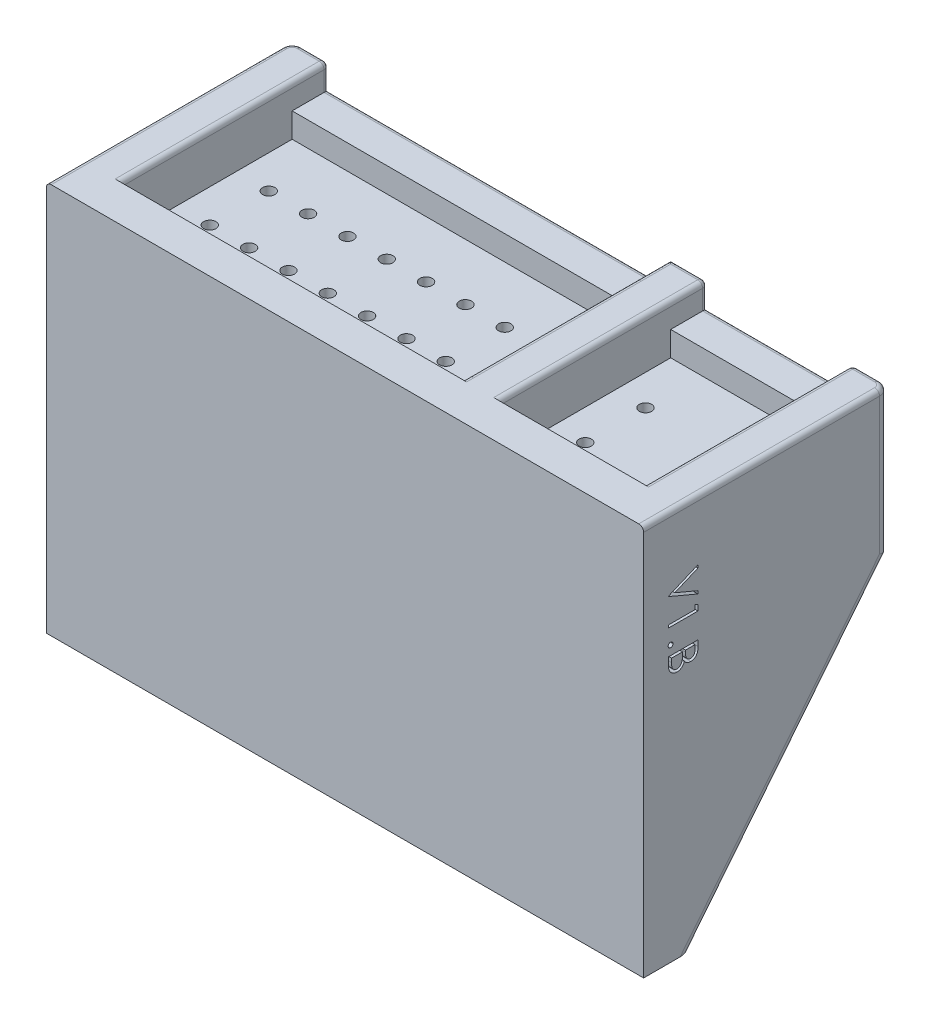
from build123d import *

# Parameters (mm, degrees)
SKETCH1_W           = 121.5
SKETCH1_H           = 50
BOSS_EXTRUDE1_DEPTH = 29.5
SKETCH2_W           = 29.5
SKETCH2_H           = 35
CUT_EXTRUDE1_DEPTH  = 10
SKETCH3_W           = 69.5
SKETCH3_H           = 35
CUT_EXTRUDE2_DEPTH  = 10
SKETCH5_R           = 1.25
CUT_EXTRUDE4_DEPTH  = 69.525998716
SKETCH6_R           = 1.25
CUT_EXTRUDE5_DEPTH  = 69.525998716
SKETCH8_W           = 69.5
SKETCH8_H           = 7.5
SKETCH8_W_2         = 29.5
CUT_EXTRUDE7_DEPTH  = 5
FILLET1_R           = 1
SKETCH9_W           = 121.5
SKETCH9_H           = 10
BOSS_EXTRUDE2_DEPTH = 50
BOSS_EXTRUDE3_DEPTH = 10
FILLET3_R           = 2
SKETCH11_W          = 101.5
SKETCH11_H          = 24.25
RECESS_DEPTH        = 2
CUT_EXTRUDE9_DEPTH  = 2


with BuildPart() as part:
    # Sketch1 → Boss-Extrude1 (new body)
    with BuildSketch(Plane(origin=(0, 0, 0), x_dir=(1, 0, 0), z_dir=(0, 1, 0))):
        Rectangle(SKETCH1_W, SKETCH1_H)
    extrude(amount=BOSS_EXTRUDE1_DEPTH)

    # Sketch2 → Cut-Extrude1 (cut)
    with BuildSketch(Plane(origin=(0, 29.5, 0), x_dir=(1, 0, 0), z_dir=(0, 1, 0))):
        with Locations((38.5, 0)):
            Rectangle(SKETCH2_W, SKETCH2_H)
    extrude(amount=-CUT_EXTRUDE1_DEPTH, mode=Mode.SUBTRACT)

    # Sketch3 → Cut-Extrude2 (cut)
    with BuildSketch(Plane(origin=(0, 29.5, 0), x_dir=(1, 0, 0), z_dir=(0, 1, 0))):
        with Locations((-18.5, 0)):
            Rectangle(SKETCH3_W, SKETCH3_H)
    extrude(amount=-CUT_EXTRUDE2_DEPTH, mode=Mode.SUBTRACT)

    # Sketch5 → Cut-Extrude4 (cut, through all)
    with BuildSketch(Plane(origin=(0, 19.5, 0), x_dir=(1, 0, 0), z_dir=(0, 1, 0))):
        with Locations(Location((-46.5, 6, 0), (0, 0, 270))):
            Circle(SKETCH5_R)
        with Locations(Location((-38.5, 6, 0), (0, 0, 270))):
            Circle(SKETCH5_R)
        with Locations(Location((-30.5, 6, 0), (0, 0, 270))):
            Circle(SKETCH5_R)
        with Locations(Location((-22.5, 6, 0), (0, 0, 270))):
            Circle(SKETCH5_R)
        with Locations(Location((-14.5, 6, 0), (0, 0, 270))):
            Circle(SKETCH5_R)
        with Locations(Location((-6.5, 6, 0), (0, 0, 270))):
            Circle(SKETCH5_R)
        with Locations(Location((1.5, 6, 0), (0, 0, 270))):
            Circle(SKETCH5_R)
        with Locations(Location((9.5, 6, 0), (0, 0, 270))):
            Circle(SKETCH5_R)
        with Locations(Location((-38.5, -6, 0), (0, 0, 270))):
            Circle(SKETCH5_R)
        with Locations(Location((-30.5, -6, 0), (0, 0, 270))):
            Circle(SKETCH5_R)
        with Locations(Location((-22.5, -6, 0), (0, 0, 270))):
            Circle(SKETCH5_R)
        with Locations(Location((-14.5, -6, 0), (0, 0, 270))):
            Circle(SKETCH5_R)
        with Locations(Location((-6.5, -6, 0), (0, 0, 270))):
            Circle(SKETCH5_R)
        with Locations(Location((1.5, -6, 0), (0, 0, 270))):
            Circle(SKETCH5_R)
        with Locations(Location((9.5, -6, 0), (0, 0, 270))):
            Circle(SKETCH5_R)
        with Locations(Location((-46.5, -6, 0), (0, 0, 270))):
            Circle(SKETCH5_R)
    extrude(amount=-CUT_EXTRUDE4_DEPTH, mode=Mode.SUBTRACT)

    # Sketch6 → Cut-Extrude5 (cut, through all)
    with BuildSketch(Plane(origin=(0, 19.5, 0), x_dir=(1, 0, 0), z_dir=(0, 1, 0))):
        with Locations(Location((30, 6.125, 0), (0, 0, 270))):
            Circle(SKETCH6_R)
        with Locations(Location((46, 6.125, 0), (0, 0, 270))):
            Circle(SKETCH6_R)
    cut_extrude5 = extrude(amount=-CUT_EXTRUDE5_DEPTH, mode=Mode.SUBTRACT)

    # Mirror3: Cut-Extrude5 across plane
    add(cut_extrude5.mirror(Plane.XY), mode=Mode.SUBTRACT)

    # Sketch8 → Cut-Extrude7 (cut)
    with BuildSketch(Plane(origin=(0, 29.5, 0), x_dir=(1, 0, 0), z_dir=(0, 1, 0))):
        with Locations((-18.5, 21.25)):
            Rectangle(SKETCH8_W, SKETCH8_H)
        with Locations((38.5, 21.25)):
            Rectangle(SKETCH8_W_2, SKETCH8_H)
    extrude(amount=-CUT_EXTRUDE7_DEPTH, mode=Mode.SUBTRACT)

    # Fillet1
    fillet1_edges = [part.edges().sort_by_distance(p)[0] for p in [
        (20, 29.5, -25),
        (-60.75, 29.5, 0),
        (-57, 29.5, -25),
        (-18.5, 24.5, -25),
        (-53.25, 27, -25),
        (38.5, 24.5, -25),
        (23.75, 27, -25),
        (53.25, 27, -25),
        (53.25, 29.5, -3.75),
        (23.75, 29.5, -3.75),
        (16.25, 29.5, -3.75),
        (-53.25, 29.5, -3.75),
        (60.75, 29.5, 0),
        (57, 29.5, -25),
    ]]
    fillet(fillet1_edges, radius=FILLET1_R)

    # Sketch9 → Boss-Extrude2 (add)
    with BuildSketch(Plane.XZ):
        with Locations((0, 20)):
            Rectangle(SKETCH9_W, SKETCH9_H)
    extrude(amount=BOSS_EXTRUDE2_DEPTH)

    # Sketch10 → Boss-Extrude3 (add)
    with BuildSketch(Plane.ZY.offset(60.75)):
        Polygon((-25, 0), (15, -50), (15, 0), align=None)
    boss_extrude3 = extrude(amount=-BOSS_EXTRUDE3_DEPTH)

    # Mirror4: Boss-Extrude3 across plane
    add(boss_extrude3.mirror(Plane(origin=(0, 0, 0), x_dir=(0, 0, 1), z_dir=(1, 0, 0))))

    # Fillet3
    # the kernel refuses this fillet: 2 mm, written as the material it takes off along each edge
    with BuildSketch(Plane(origin=(58.75, 29.5, -23), x_dir=(1, 0, 0), z_dir=(0, 0, 1))) as fillet3_piece_1:
        with BuildLine():
            CenterArc((1, -1), 1, 0, 90)
            Line((2, -1), (2, 0))
            Line((2, 0), (1, 0))
        make_face()
    revolve(axis=Axis((58.75, 29.5, -23), (0, 1, 0)), revolution_arc=90, mode=Mode.SUBTRACT)
    with BuildSketch(Plane(origin=(-58.75, 29.5, -23), x_dir=(0, 0, -1), z_dir=(1, 0, 0))) as fillet3_piece_2:
        with BuildLine():
            CenterArc((1, -1), 1, 0, 90)
            Line((2, -1), (2, 0))
            Line((2, 0), (1, 0))
        make_face()
    revolve(axis=Axis((-58.75, 29.5, -23), (0, 1, 0)), revolution_arc=90, mode=Mode.SUBTRACT)
    with BuildSketch(Plane(origin=(60.75, -5, -25), x_dir=(0, 0, 1), z_dir=(0, 1, 0))) as fillet3_piece_3:
        with BuildLine():
            CenterArc((FILLET3_R, -FILLET3_R), FILLET3_R, 90, 90)
            Line((0, -FILLET3_R), (0, 0))
            Line((0, 0), (FILLET3_R, 0))
        make_face()
    extrude(amount=34.5, mode=Mode.SUBTRACT)
    with BuildSketch(Plane(origin=(-60.75, -5, -25), x_dir=(0, 0, 1), z_dir=(0, 1, 0))) as fillet3_piece_4:
        with BuildLine():
            CenterArc((FILLET3_R, FILLET3_R), FILLET3_R, 180, 90)
            Line((0, FILLET3_R), (0, 0))
            Line((0, 0), (FILLET3_R, 0))
        make_face()
    extrude(amount=34.5, mode=Mode.SUBTRACT)
    with BuildSketch(Plane(origin=(-50.75, 3.904344047, -28.123475238), x_dir=(-1, 0, 0), z_dir=(0, -0.7808688094430305, 0.6246950475544242))) as fillet3_piece_5_section:
        with BuildLine():
            CenterArc((FILLET3_R, -FILLET3_R), FILLET3_R, 90, 90)
            Line((0, -FILLET3_R), (0, 0))
            Line((0, 0), (FILLET3_R, 0))
        make_face()
    fillet3_piece_5 = extrude(amount=74.031242374, mode=Mode.PRIVATE)
    fillet3_piece_5 = split(fillet3_piece_5, bisect_by=Plane(origin=(-51.199423068, -24.646092888, 15), z_dir=(0, 0, -1)), keep=Keep.TOP, mode=Mode.PRIVATE)
    fillet3_piece_5 = split(fillet3_piece_5, bisect_by=Plane(origin=(-51.199423068, 0, -4.716874311), z_dir=(0, -1, 0)), keep=Keep.TOP, mode=Mode.PRIVATE)
    add(fillet3_piece_5, mode=Mode.SUBTRACT)
    with BuildSketch(Plane(origin=(-60.75, 3.904344047, -28.123475238), x_dir=(0, 0.6246950475544242, 0.7808688094430305), z_dir=(0, -0.7808688094430305, 0.6246950475544242))) as fillet3_piece_6:
        with BuildLine():
            CenterArc((FILLET3_R, -FILLET3_R), FILLET3_R, 90, 90)
            Line((0, -FILLET3_R), (0, 0))
            Line((0, 0), (FILLET3_R, 0))
        make_face()
    extrude(amount=74.031242374, mode=Mode.SUBTRACT)
    with BuildSketch(Plane(origin=(60.75, 3.904344047, -28.123475238), x_dir=(0, 0.6246950475544242, 0.7808688094430305), z_dir=(0, -0.7808688094430305, 0.6246950475544242))) as fillet3_piece_7:
        with BuildLine():
            CenterArc((FILLET3_R, FILLET3_R), FILLET3_R, 180, 90)
            Line((0, FILLET3_R), (0, 0))
            Line((0, 0), (FILLET3_R, 0))
        make_face()
    extrude(amount=74.031242374, mode=Mode.SUBTRACT)
    with BuildSketch(Plane(origin=(50.75, 3.904344047, -28.123475238), x_dir=(1, 0, 0), z_dir=(0, -0.7808688094430305, 0.6246950475544242))) as fillet3_piece_8_section:
        with BuildLine():
            CenterArc((FILLET3_R, FILLET3_R), FILLET3_R, 180, 90)
            Line((0, FILLET3_R), (0, 0))
            Line((0, 0), (FILLET3_R, 0))
        make_face()
    fillet3_piece_8 = extrude(amount=74.031242374, mode=Mode.PRIVATE)
    fillet3_piece_8 = split(fillet3_piece_8, bisect_by=Plane(origin=(51.199423068, -24.646092888, 15), z_dir=(0, 0, -1)), keep=Keep.TOP, mode=Mode.PRIVATE)
    fillet3_piece_8 = split(fillet3_piece_8, bisect_by=Plane(origin=(51.199423068, 0, -4.716874311), z_dir=(0, -1, 0)), keep=Keep.TOP, mode=Mode.PRIVATE)
    add(fillet3_piece_8, mode=Mode.SUBTRACT)

    # Sketch11 → Recess (cut)
    with BuildSketch(Plane.XZ):
        Rectangle(SKETCH11_W, SKETCH11_H)
    extrude(amount=-RECESS_DEPTH, mode=Mode.SUBTRACT)

    # Sketch12 → Cut-Extrude9 (cut)
    # profile 1 of 4: a face of its own
    with BuildSketch(Plane(origin=(60.75, 0, 0), x_dir=(0, 0, -1), z_dir=(1, 0, 0))):
        Polygon((-13.940758113, 17.276238766), (-13.940758113, 16.699315689), (-18.669123497, 14.699315689), (-13.940758113, 12.699315689), (-13.940758113, 12.122392612), (-19.940758113, 14.660854151), (-19.940758113, 14.737777228), align=None)
    # profile 2 of 4: a face of its own
    with BuildSketch(Plane(origin=(60.75, 0, 0), x_dir=(0, 0, -1), z_dir=(1, 0, 0))):
        Polygon((-13.940758113, 10.231767612), (-13.940758113, 9.122392612), (-19.940758113, 9.122392612), (-19.940758113, 9.660854151), (-14.556142728, 9.660854151), (-14.556142728, 10.583931074), align=None)
    # profile 3 of 4: a face of its own
    with BuildSketch(Plane(origin=(60.75, 0, 0), x_dir=(0, 0, -1), z_dir=(1, 0, 0))):
        with BuildLine():
            add(Edge.make_bspline(
                [(-19.01768119, 5.93008492), (-19.01960101, 5.896650002), (-19.023342468, 5.831490108), (-19.050840317, 5.73713661), (-19.097237105, 5.650914544), (-19.160986767, 5.57458718), (-19.23709519, 5.51114936), (-19.323098229, 5.464218711), (-19.41772527, 5.435460436), (-19.48382511, 5.431905662), (-19.51768119, 5.43008492)],
                knots=[0, 0, 0, 0, 1.020591893, 1.988988293, 2.974634352, 3.991697318, 5.008760285, 5.983632262, 6.967224335, 8, 8, 8, 8], degree=3))
            add(Edge.make_bspline(
                [(-19.51768119, 5.43008492), (-19.550723187, 5.431978396), (-19.615994003, 5.435718749), (-19.709905039, 5.464159005), (-19.795965261, 5.511516804), (-19.873108364, 5.574154184), (-19.936994495, 5.650933118), (-19.982977569, 5.737345064), (-20.012399523, 5.831263912), (-20.015892166, 5.896611939), (-20.01768119, 5.93008492)],
                knots=[0, 0, 0, 0, 1.009852967, 1.994853009, 2.971120474, 3.99910934, 5.017628188, 6.004685157, 6.977947174, 8, 8, 8, 8], degree=3))
            add(Edge.make_bspline(
                [(-20.01768119, 5.93008492), (-20.015825003, 5.963533799), (-20.012179922, 6.029218925), (-19.983565099, 6.123489653), (-19.936553651, 6.209378533), (-19.873226444, 6.286172419), (-19.795565636, 6.348289549), (-19.710490943, 6.397829064), (-19.615722721, 6.423993535), (-19.550669755, 6.428035319), (-19.51768119, 6.43008492)],
                knots=[0, 0, 0, 0, 1.021616397, 2.006195831, 2.982046417, 4.000130345, 5.027680246, 6.00943514, 6.990578253, 8, 8, 8, 8], degree=3))
            add(Edge.make_bspline(
                [(-19.51768119, 6.43008492), (-19.483880451, 6.428102497), (-19.418001008, 6.424238648), (-19.322512564, 6.397768388), (-19.237491006, 6.348663784), (-19.160869869, 6.285738396), (-19.097676535, 6.209397404), (-19.050261688, 6.123692274), (-19.023558819, 6.028996625), (-19.019666618, 5.963496712), (-19.01768119, 5.93008492)],
                knots=[0, 0, 0, 0, 1.032329927, 2.012066096, 2.992413168, 4.009037178, 5.025661188, 6.000112418, 6.979848586, 8, 8, 8, 8], degree=3))
        make_face()
    # profile 4 of 4: a face of its own
    with BuildSketch(Plane(origin=(60.75, 0, 0), x_dir=(0, 0, -1), z_dir=(1, 0, 0))):
        with BuildLine():
            Line((-13.940758113, 4.045469535), (-13.940758113, 2.874796459))
            add(Edge.make_bspline(
                [(-13.940758113, 2.874796459), (-13.941059399, 2.817490496), (-13.941643367, 2.706417278), (-13.950700163, 2.544898235), (-13.963049312, 2.39361456), (-13.982643756, 2.252522378), (-14.006286803, 2.121686889), (-14.034918488, 2.000713796), (-14.069249825, 1.889987787), (-14.12384345, 1.757794524), (-14.204968882, 1.607073391), (-14.324846422, 1.443876147), (-14.471473502, 1.304326022), (-14.636872339, 1.184006621), (-14.818819377, 1.088347559), (-15.012977986, 1.019143049), (-15.216843829, 0.975329549), (-15.356803563, 0.970823661), (-15.427536959, 0.968546459)],
                knots=[0, 0, 0, 0, 1.001505555, 1.941167018, 2.826882275, 3.653841531, 4.429895133, 5.150066043, 5.825578002, 6.45369114, 7.647487171, 8.808567382, 9.977351308, 11.170798116, 12.373658725, 13.556498008, 14.765093433, 16, 16, 16, 16], degree=3))
            add(Edge.make_bspline(
                [(-15.427536959, 0.968546459), (-15.49380971, 0.970384327), (-15.624041916, 0.973995911), (-15.814214091, 1.009707315), (-15.995987607, 1.062876501), (-16.167121573, 1.14006245), (-16.325416547, 1.239347466), (-16.469931788, 1.358825523), (-16.597165089, 1.501079769), (-16.6679989, 1.607831189), (-16.703979267, 1.662056074)],
                knots=[0, 0, 0, 0, 1.044266239, 2.052081639, 3.041743201, 4.026043445, 5.00270663, 5.980942822, 6.97441044, 8, 8, 8, 8], degree=3))
            add(Edge.make_bspline(
                [(-16.703979267, 1.662056074), (-16.730127642, 1.593883926), (-16.780155962, 1.463453718), (-16.869086709, 1.283835464), (-16.964722028, 1.128461688), (-17.069713359, 0.99716137), (-17.184298057, 0.88656117), (-17.306181626, 0.787239896), (-17.441364565, 0.704030936), (-17.585997632, 0.632547426), (-17.739065723, 0.576290652), (-17.899868797, 0.536485294), (-18.066608785, 0.512026839), (-18.18025903, 0.508691684), (-18.237633113, 0.507007997)],
                knots=[0, 0, 0, 0, 1.272302504, 2.434229863, 3.488457646, 4.447234501, 5.35599188, 6.26022912, 7.18267843, 8.11661068, 9.06895546, 10.019249207, 11.000057067, 12, 12, 12, 12], degree=3))
            add(Edge.make_bspline(
                [(-18.237633113, 0.507007997), (-18.296204561, 0.508683116), (-18.411445528, 0.511978959), (-18.580744788, 0.536279975), (-18.742512977, 0.577466032), (-18.89790029, 0.634057924), (-19.04602718, 0.708337124), (-19.188748814, 0.796784294), (-19.322263181, 0.90443571), (-19.449745403, 1.024428452), (-19.564299756, 1.160333139), (-19.666284938, 1.306942385), (-19.750542062, 1.466364913), (-19.820435405, 1.6361285), (-19.874602389, 1.817361232), (-19.912207621, 2.009391141), (-19.937605073, 2.212259957), (-19.939689266, 2.351477675), (-19.940758113, 2.422873382)],
                knots=[0, 0, 0, 0, 0.978404568, 1.925038397, 2.85041836, 3.763147166, 4.682162379, 5.614488577, 6.562659439, 7.54271123, 8.535210642, 9.526693784, 10.520907202, 11.541451354, 12.589717429, 13.675358278, 14.807842563, 16, 16, 16, 16], degree=3))
            Line((-19.940758113, 2.422873382), (-19.940758113, 4.045469535))
            Line((-19.940758113, 4.045469535), (-13.940758113, 4.045469535))
        make_face()
        with BuildLine():
            Line((-14.556142728, 3.507007997), (-16.479219651, 3.507007997))
            Line((-16.479219651, 3.507007997), (-16.479219651, 3.145229151))
            add(Edge.make_bspline(
                [(-16.479219651, 3.145229151), (-16.478539774, 3.092345025), (-16.477226113, 2.990162118), (-16.473344493, 2.841791905), (-16.462951742, 2.704413644), (-16.451959695, 2.577553955), (-16.43503419, 2.462063107), (-16.414322128, 2.357554468), (-16.392608726, 2.263089222), (-16.355578092, 2.154199562), (-16.301405582, 2.030720131), (-16.215357388, 1.899923022), (-16.115651812, 1.78274257), (-15.998482843, 1.684898369), (-15.870560287, 1.6041598), (-15.73187274, 1.550278383), (-15.587834516, 1.512061002), (-15.488691425, 1.508709586), (-15.438354267, 1.507007997)],
                knots=[0, 0, 0, 0, 1.156481963, 2.23455883, 3.244418989, 4.168404366, 5.01828131, 5.794834307, 6.498111525, 7.13526334, 8.307595709, 9.435046769, 10.546766856, 11.659452936, 12.760769924, 13.837671619, 14.902137667, 16, 16, 16, 16], degree=3))
            add(Edge.make_bspline(
                [(-15.438354267, 1.507007997), (-15.40503726, 1.507859033), (-15.339682312, 1.509528433), (-15.244776828, 1.524721959), (-15.154376006, 1.546767914), (-15.070559003, 1.58121042), (-14.990943501, 1.62285853), (-14.919065756, 1.677035162), (-14.850987877, 1.73821895), (-14.789209515, 1.810073352), (-14.733855861, 1.892250447), (-14.685149501, 1.985533231), (-14.646728531, 2.091035548), (-14.612262876, 2.206365253), (-14.588347467, 2.333368095), (-14.568351001, 2.470803082), (-14.558186243, 2.619836119), (-14.556839093, 2.722941709), (-14.556142728, 2.776238766)],
                knots=[0, 0, 0, 0, 0.911752476, 1.788502045, 2.626783689, 3.45400582, 4.26402138, 5.080402872, 5.911472738, 6.767166405, 7.66795952, 8.620018292, 9.640966946, 10.73819047, 11.913090943, 13.176185384, 14.540321519, 16, 16, 16, 16], degree=3))
            Line((-14.556142728, 2.776238766), (-14.556142728, 3.507007997))
        make_face(mode=Mode.SUBTRACT)
        with BuildLine():
            Line((-17.094604267, 3.507007997), (-19.325373497, 3.507007997))
            Line((-19.325373497, 3.507007997), (-19.325373497, 2.740181074))
            add(Edge.make_bspline(
                [(-19.325373497, 2.740181074), (-19.324717942, 2.685291214), (-19.323454446, 2.579498247), (-19.319284628, 2.426756903), (-19.309999063, 2.285571129), (-19.294861116, 2.155859682), (-19.279131469, 2.036480748), (-19.257360878, 1.928620359), (-19.232610348, 1.832113157), (-19.19430773, 1.72022483), (-19.134905506, 1.594150489), (-19.04475627, 1.458381117), (-18.93877155, 1.336465794), (-18.814561363, 1.234123987), (-18.680526539, 1.149614135), (-18.537368125, 1.090342445), (-18.389453457, 1.052231598), (-18.288341771, 1.047728094), (-18.237633113, 1.045469535)],
                knots=[0, 0, 0, 0, 1.159821618, 2.235403267, 3.228114831, 4.14795534, 4.994323282, 5.771256229, 6.471395042, 7.097801288, 8.267864287, 9.404187171, 10.531774336, 11.667624178, 12.792825787, 13.866573821, 14.930062559, 16, 16, 16, 16], degree=3))
            add(Edge.make_bspline(
                [(-18.237633113, 1.045469535), (-18.205926142, 1.045931178), (-18.143023636, 1.046847016), (-18.050656314, 1.061178344), (-17.960783874, 1.081171481), (-17.874765316, 1.110123262), (-17.791200937, 1.146629111), (-17.711546296, 1.192442567), (-17.633896821, 1.24534843), (-17.535843131, 1.32811068), (-17.422830173, 1.448376207), (-17.312198589, 1.619311906), (-17.22297261, 1.81366165), (-17.185087959, 1.954623461), (-17.165517728, 2.027440689)],
                knots=[0, 0, 0, 0, 0.723503378, 1.435336582, 2.130201219, 2.824764462, 3.504949994, 4.209866579, 4.920640069, 5.648298893, 7.13757748, 8.670694625, 10.280166878, 12, 12, 12, 12], degree=3))
            add(Edge.make_bspline(
                [(-17.165517728, 2.027440689), (-17.159594329, 2.056633398), (-17.146751178, 2.119929211), (-17.133202771, 2.223142731), (-17.121049409, 2.341370765), (-17.112295593, 2.474107986), (-17.102898524, 2.621882308), (-17.09937405, 2.784646256), (-17.095072244, 2.962514898), (-17.094764249, 3.085930545), (-17.094604267, 3.150036843)],
                knots=[0, 0, 0, 0, 0.634452549, 1.375623993, 2.216454381, 3.166361212, 4.209414599, 5.370755378, 6.634280627, 8, 8, 8, 8], degree=3))
            Line((-17.094604267, 3.150036843), (-17.094604267, 3.507007997))
        make_face(mode=Mode.SUBTRACT)
    extrude(amount=-CUT_EXTRUDE9_DEPTH, mode=Mode.SUBTRACT)


solid = part.part
